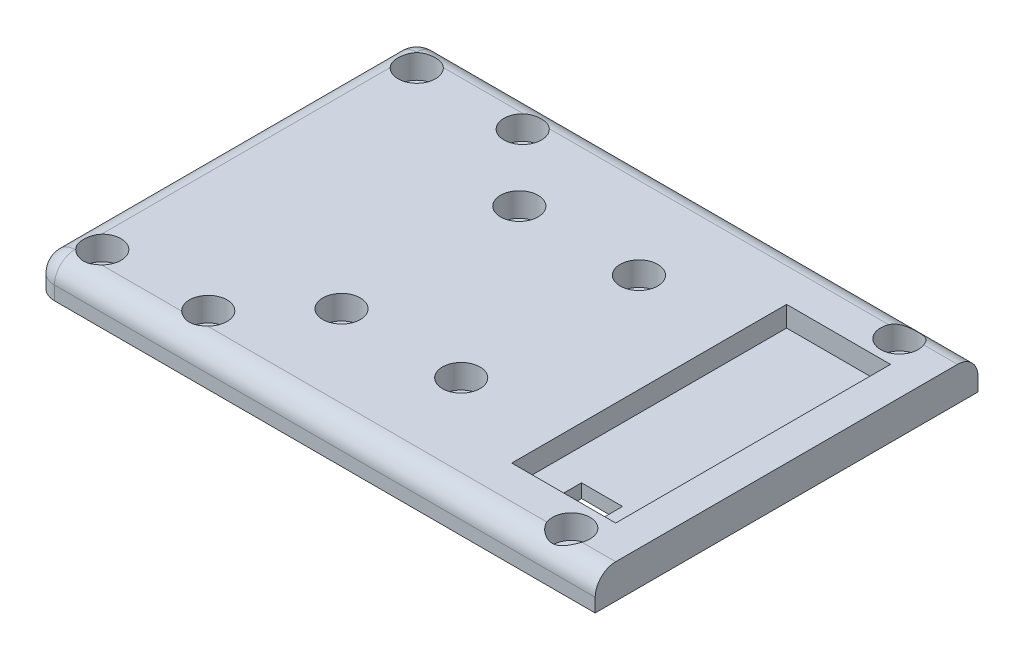
from build123d import *

# Parameters (mm, degrees)
SKETCH1_W                        = 82.1
SKETCH1_H                        = 56
BOSS_EXTRUDE1_DEPTH              = 5
CBORE_FOR_M2_5_SHCS1_D           = 2.9
CBORE_FOR_M2_5_SHCS1_CBORE_D     = 5.5
CBORE_FOR_M2_5_SHCS1_CBORE_DEPTH = 3.5
FILLET1_R                        = 3
FILLET2_R                        = 3
SKETCH4_W                        = 15
SKETCH4_H                        = 40
CUT_EXTRUDE1_DEPTH               = 3
SKETCH5_W                        = 6
SKETCH5_H                        = 3
CUT_EXTRUDE2_DEPTH               = 50.780543533
MOVE_FACE1_BY                    = 0.1
MOVE_FACE1_2_BY                  = 0.1
MOVE_FACE1_3_BY                  = 0.1
MOVE_FACE1_4_BY                  = 0.1


with BuildPart() as part:
    # Sketch1 → Boss-Extrude1 (new body)
    with BuildSketch(Plane(origin=(0, 0, 0), x_dir=(1, 0, 0), z_dir=(0, 1, 0))):
        Rectangle(SKETCH1_W, SKETCH1_H)
    extrude(amount=BOSS_EXTRUDE1_DEPTH)

    # CBORE for M2.5 SHCS1 (through all)
    with Locations(Plane(origin=(0, 5, 0), x_dir=(1, 0, 0), z_dir=(0, 1, 0))):
        with Locations((-36.05, 23), (-36.05, -23), (-20.55, -23), (-20.55, 23), (-11.05, -13), (-11.05, 13), (6.45, 13), (6.45, -13), (33.55, 24), (33.55, -24)):
            CounterBoreHole(CBORE_FOR_M2_5_SHCS1_D / 2, CBORE_FOR_M2_5_SHCS1_CBORE_D / 2, CBORE_FOR_M2_5_SHCS1_CBORE_DEPTH)

    # Fillet1
    fillet1_edges = [part.edges().sort_by_distance(p)[0] for p in [
        (-41.05, 2.5, 28),
        (-41.05, 2.5, -28),
    ]]
    fillet(fillet1_edges, radius=FILLET1_R)

    # Fillet2
    # the kernel refuses this fillet: 3 mm, written as the material it takes off along each edge
    with BuildSketch(Plane(origin=(-38.05, 5, 28), x_dir=(0, -1, 0), z_dir=(1, 0, 0))) as fillet2_piece_1:
        with BuildLine():
            CenterArc((FILLET2_R, FILLET2_R), FILLET2_R, 180, 90)
            Line((0, FILLET2_R), (0, 0))
            Line((0, 0), (FILLET2_R, 0))
        make_face()
    extrude(amount=86.6, mode=Mode.SUBTRACT)
    with BuildSketch(Plane(origin=(-38.05, 5, 25), x_dir=(0, 0, 1), z_dir=(1, 0, 0))) as fillet2_piece_2:
        with BuildLine():
            CenterArc((3 - FILLET2_R, FILLET2_R), FILLET2_R, 270, 90)
            Line((3 - FILLET2_R, 0), (3, 0))
            Line((3, 0), (3, FILLET2_R))
        make_face()
    revolve(axis=Axis((-38.05, 5, 25), (0, -1, 0)), revolution_arc=90, mode=Mode.SUBTRACT)
    with BuildSketch(Plane(origin=(-38.05, 5, -25), x_dir=(-1, 0, 0), z_dir=(0, 0, 1))) as fillet2_piece_3:
        with BuildLine():
            CenterArc((3 - FILLET2_R, FILLET2_R), FILLET2_R, 270, 90)
            Line((3, FILLET2_R), (3, 0))
            Line((3, 0), (3 - FILLET2_R, 0))
        make_face()
    revolve(axis=Axis((-38.05, 5, -25), (0, -1, 0)), revolution_arc=90, mode=Mode.SUBTRACT)
    with BuildSketch(Plane(origin=(48.55, 5, -28), x_dir=(0, 0, 1), z_dir=(-1, 0, 0))) as fillet2_piece_4:
        with BuildLine():
            CenterArc((FILLET2_R, -FILLET2_R), FILLET2_R, 90, 90)
            Line((0, -FILLET2_R), (0, 0))
            Line((0, 0), (FILLET2_R, 0))
        make_face()
    extrude(amount=86.6, mode=Mode.SUBTRACT)
    with BuildSketch(Plane(origin=(-41.05, 5, -25), x_dir=(1, 0, 0), z_dir=(0, 0, 1))) as fillet2_piece_5:
        with BuildLine():
            CenterArc((FILLET2_R, -FILLET2_R), FILLET2_R, 90, 90)
            Line((0, -FILLET2_R), (0, 0))
            Line((0, 0), (FILLET2_R, 0))
        make_face()
    extrude(amount=50, mode=Mode.SUBTRACT)

    # Sketch4 → Cut-Extrude1 (cut)
    with BuildSketch(Plane(origin=(0, 5, 0), x_dir=(1, 0, 0), z_dir=(0, 1, 0))):
        with Locations((28.55, 0)):
            Rectangle(SKETCH4_W, SKETCH4_H)
    extrude(amount=-CUT_EXTRUDE1_DEPTH, mode=Mode.SUBTRACT)

    # Sketch5 → Cut-Extrude2 (cut, through all)
    with BuildSketch(Plane(origin=(0, 2, 0), x_dir=(1, 0, 0), z_dir=(0, 1, 0))):
        with Locations((28.55, -16)):
            Rectangle(SKETCH5_W, SKETCH5_H)
    extrude(amount=-CUT_EXTRUDE2_DEPTH, mode=Mode.SUBTRACT)

    # Move Face1: a face moved inward by 0.1
    extrude(part.faces().sort_by_distance((28.55, 3.5, 20))[0], amount=MOVE_FACE1_BY, dir=(0, 0, 1), mode=Mode.SUBTRACT)

    # Move Face1 2: a face moved inward by 0.1
    extrude(part.faces().sort_by_distance((36.05, 3.5, 0))[0], amount=MOVE_FACE1_2_BY, dir=(1, 0, 0), mode=Mode.SUBTRACT)

    # Move Face1 3: a face moved inward by 0.1
    extrude(part.faces().sort_by_distance((28.55, 3.5, -20))[0], amount=MOVE_FACE1_3_BY, dir=(0, 0, -1), mode=Mode.SUBTRACT)

    # Move Face1 4: a face moved inward by 0.1
    extrude(part.faces().sort_by_distance((21.05, 3.5, 0))[0], amount=MOVE_FACE1_4_BY, dir=(-1, 0, 0), mode=Mode.SUBTRACT)


solid = part.part
